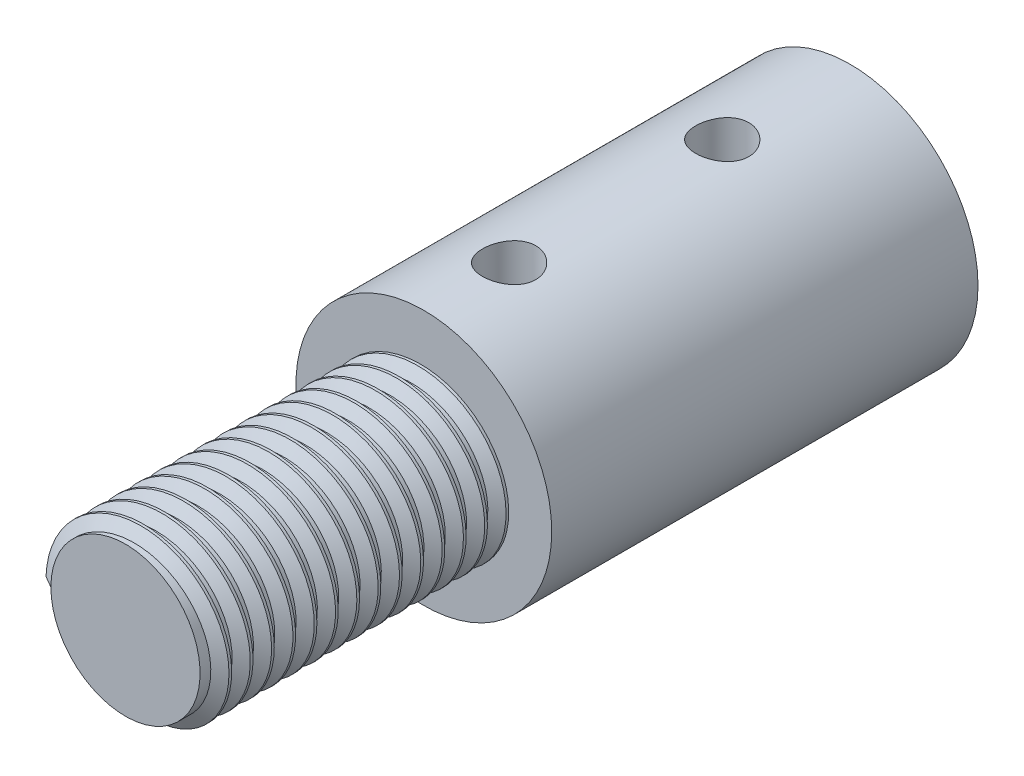
from build123d import *

# Parameters (mm, degrees)
SKETCH_1_R               = 6
EXTRUDE_1_DEPTH          = 34
SKETCH_1_3_R             = 2.1
CUT_EXTRUDE_2_DEPTH      = 11
SKETCH_2_R               = 1.25
CUT_EXTRUDE_3_DEPTH      = 36.042830936
SKETCH_4_R               = 1.25
CUT_EXTRUDE_5_DEPTH      = 36.042831073
CUT_EXTRUDE_6_DEPTH      = 2
CUT_EXTRUDE_6_DEPTH_BACK = 36.042831073
SKETCH_5_R               = 3.1
CUT_EXTRUDE_START        = -14
SKETCH_8_R               = 6
SKETCH_8_R_2             = 3.5
CUT_EXTRUDE_7_DEPTH      = 14
THREAD_1_PITCH           = 1


with BuildPart() as part:
    # 草图1 → 凸台-拉伸1 (new body)
    with BuildSketch(Plane.XY):
        Circle(SKETCH_1_R)
    extrude(amount=EXTRUDE_1_DEPTH)

    # 草图1<3> → 切除-拉伸2 (cut)
    with BuildSketch(Plane.XY):
        Circle(SKETCH_1_3_R)
    extrude(amount=CUT_EXTRUDE_2_DEPTH, mode=Mode.SUBTRACT)

    # 草图2 → 切除-拉伸3 (cut, through all)
    with BuildSketch(Plane(origin=(0, 0, 0), x_dir=(1, 0, 0), z_dir=(0, 1, 0))):
        with Locations(Location((0, -6, 0), (0, 0, 90))):
            Circle(SKETCH_2_R)
    extrude(amount=CUT_EXTRUDE_3_DEPTH, mode=Mode.SUBTRACT)

    # 草图4 → 切除-拉伸5 (cut, through all)
    with BuildSketch(Plane(origin=(0, 0, 0), x_dir=(1, 0, 0), z_dir=(0, 1, 0))):
        with Locations(Location((0, -16, 0), (0, 0, 90))):
            Circle(SKETCH_4_R)
    extrude(amount=CUT_EXTRUDE_5_DEPTH, mode=Mode.SUBTRACT)

    # 草图5 → 切除-拉伸6 (cut, two sides: drawn at the far end of the back side and taken through both)
    with BuildSketch(Plane(origin=(0, 0, 0), x_dir=(0, 0, -1), z_dir=(1, 0, 0)).offset(-CUT_EXTRUDE_6_DEPTH_BACK)):
        with Locations(Location((-16, 0, 0), (0, 0, 180))):
            Circle(SKETCH_5_R)
    extrude(amount=CUT_EXTRUDE_6_DEPTH + CUT_EXTRUDE_6_DEPTH_BACK, mode=Mode.SUBTRACT)

    # 草图8 → 切除-拉伸7 (cut)
    with BuildSketch(Plane.XY.offset(34).offset(CUT_EXTRUDE_START)):
        Circle(SKETCH_8_R)
        Circle(SKETCH_8_R_2, mode=Mode.SUBTRACT)
    extrude(amount=CUT_EXTRUDE_7_DEPTH, mode=Mode.SUBTRACT)

    # 螺纹线1: the profile of Sketch 3 profile screwed along a right-hand helix of 14 turns, 8 arcs to a turn; built about Z, then put on its axis
    thread_1_z = Axis((0, 0, 0), (0, 0, 1))
    thread_1_corners = [(3.4997, 0, -0.000173205), (4.041265875, 0, 0.312499999), (4.041265875, 0, 0.437499999), (3.4997, 0, 0.750173202)]
    with BuildLine(mode=Mode.PRIVATE) as thread_1_profile:
        Line(thread_1_corners[0], thread_1_corners[1])
        Line(thread_1_corners[1], thread_1_corners[2])
        Line(thread_1_corners[2], thread_1_corners[3])
        Line(thread_1_corners[3], thread_1_corners[0])
    thread_1_cap = Face(thread_1_profile.wire())
    thread_1_turn_angles = [0, 22.5, 45, 67.5, 90, 112.5, 135, 157.5, 180, 202.5, 225, 247.5, 270, 292.5, 315, 337.5, 360]
    thread_1_turn_weights = [1, 0.9238795325112867, 1, 0.9238795325112867, 1, 0.9238795325112867, 1, 0.9238795325112867, 1, 0.9238795325112867, 1, 0.9238795325112867, 1, 0.9238795325112867, 1, 0.9238795325112867, 1]
    thread_1_turn_rails = [Edge.make_bspline([Vector(p[0], p[1], 0).rotate(thread_1_z, thread_1_turn_angles[k]) / thread_1_turn_weights[k] + Vector(0, 0, p[2] + THREAD_1_PITCH * thread_1_turn_angles[k] / 360) for k in range(17)], [0, 0, 0, 1, 1, 2, 2, 3, 3, 4, 4, 5, 5, 6, 6, 7, 7, 8, 8, 8], 2, thread_1_turn_weights) for p in thread_1_corners]
    thread_1_turn_sides = [Face.make_surface_from_curves(thread_1_turn_rails[p[0]], thread_1_turn_rails[p[1]]) for p in [(0, 1), (1, 2), (2, 3), (3, 0)]]
    thread_1 = Plane(origin=(0, 0, 34), x_dir=(-1, 0, 0), z_dir=(0, 0, -1)) * Solid(Shell([*[p.moved(Location((0, 0, THREAD_1_PITCH * i))) for i in range(14) for p in thread_1_turn_sides], thread_1_cap, thread_1_cap.rotate(thread_1_z, 5040).moved(Location((0, 0, THREAD_1_PITCH * 5040 / 360)))]))
    add(thread_1)


solid = part.part
